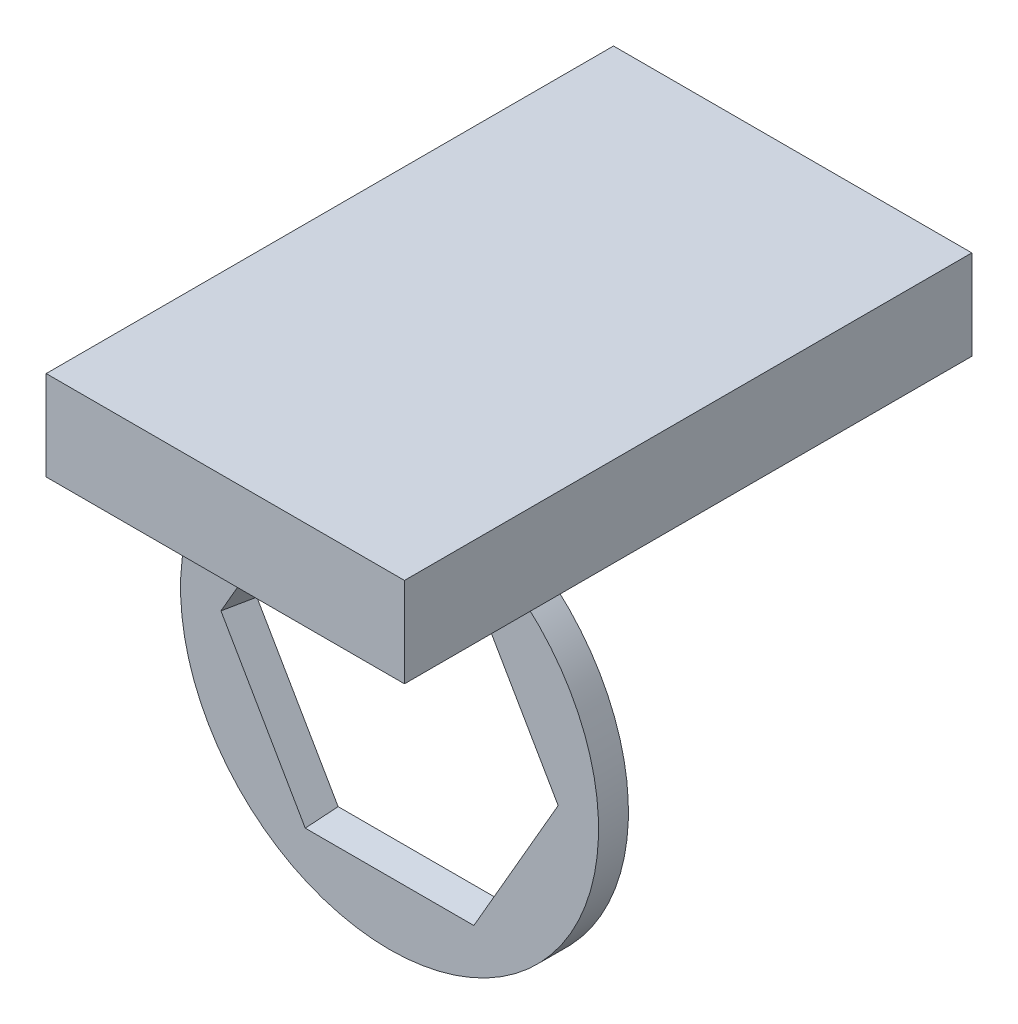
from build123d import *

# Parameters (mm, degrees)
ESQUISSE1_R               = 70
BOSS_EXTRU_1_DEPTH        = 10
CHANFREIN1_SIZE           = 10.000000024
CHANFREIN1_SIZE_2         = 1.74707794
D_PLACER_START            = -32.160153846
D_PLACER_LA_FACE1_DEPTH   = 61.565802755
D_PLACER_START_2          = -29.405648909
D_PLACER_LA_FACE1_2_DEPTH = 58.811297818
D_PLACER_LA_FACE1_3_DEPTH = 58.811297818
ESQUISSE2_W               = 120
ESQUISSE2_H               = 190
BOSS_EXTRU_2_DEPTH        = 30


with BuildPart() as part:
    # Esquisse1 → Boss.-Extru.1 (new body)
    with BuildSketch(Plane.XY):
        Circle(ESQUISSE1_R)
        Polygon((56.79394598, 0), (28.39697299, 49.185), (-28.39697299, 49.185), (-56.79394598, 0), (-28.39697299, -49.185), (28.39697299, -49.185), align=None, mode=Mode.SUBTRACT)
    extrude(amount=BOSS_EXTRU_1_DEPTH)

    # Chanfrein1
    # the kernel refuses this chamfer: 10.000000024, 1.74707794 mm, written as the material it takes off along each edge
    with BuildSketch(Plane(origin=(-54.38262227, -49.185, 10), x_dir=(0, 0, -1), z_dir=(1, 0, 0))) as chanfrein1_piece_1_section:
        Polygon((CHANFREIN1_SIZE, 0), (0, -CHANFREIN1_SIZE_2), (0, 0), align=None)
    chanfrein1_piece_1 = extrude(amount=108.76524454, mode=Mode.PRIVATE)
    chanfrein1_piece_1 = split(chanfrein1_piece_1, bisect_by=Plane(origin=(7.702074175, -85.029616205, 10), z_dir=(-0.8660254037844389, 0.4999999999999996, 0)), keep=Keep.TOP, mode=Mode.PRIVATE)
    chanfrein1_piece_1 = split(chanfrein1_piece_1, bisect_by=Plane(origin=(-34.89338531, -37.932883795, 10), z_dir=(0.8660254037844386, 0.5000000000000001, 0)), keep=Keep.TOP, mode=Mode.PRIVATE)
    add(chanfrein1_piece_1, mode=Mode.SUBTRACT)
    with BuildSketch(Plane(origin=(15.40414835, -71.68923241, 10), x_dir=(0, 0, -1), z_dir=(0.4999999999999996, 0.8660254037844389, 0))) as chanfrein1_piece_2_section:
        Polygon((CHANFREIN1_SIZE, 0), (0, -CHANFREIN1_SIZE_2), (0, 0), align=None)
    chanfrein1_piece_2 = extrude(amount=108.76524454, mode=Mode.PRIVATE)
    chanfrein1_piece_2 = split(chanfrein1_piece_2, bisect_by=Plane(origin=(15.40414835, -49.185, 10), z_dir=(0, 1, 0)), keep=Keep.TOP, mode=Mode.PRIVATE)
    chanfrein1_piece_2 = split(chanfrein1_piece_2, bisect_by=Plane(origin=(77.488844795, -35.844616205, 10), z_dir=(-0.8660254037844386, -0.5000000000000001, 0)), keep=Keep.TOP, mode=Mode.PRIVATE)
    add(chanfrein1_piece_2, mode=Mode.SUBTRACT)
    with BuildSketch(Plane(origin=(69.78677062, -22.50423241, 10), x_dir=(0, 0, -1), z_dir=(-0.5000000000000001, 0.8660254037844386, 0))) as chanfrein1_piece_3_section:
        Polygon((CHANFREIN1_SIZE, 0), (0, -CHANFREIN1_SIZE_2), (0, 0), align=None)
    chanfrein1_piece_3 = extrude(amount=108.76524454, mode=Mode.PRIVATE)
    chanfrein1_piece_3 = split(chanfrein1_piece_3, bisect_by=Plane(origin=(50.29753366, -11.252116205, 10), z_dir=(-0.8660254037844389, 0.4999999999999996, 0)), keep=Keep.TOP, mode=Mode.PRIVATE)
    chanfrein1_piece_3 = split(chanfrein1_piece_3, bisect_by=Plane(origin=(69.78677062, 49.185, 10), z_dir=(0, -1, 0)), keep=Keep.TOP, mode=Mode.PRIVATE)
    add(chanfrein1_piece_3, mode=Mode.SUBTRACT)
    with BuildSketch(Plane(origin=(54.38262227, 49.185, 10), x_dir=(0, 0, -1), z_dir=(-1, 0, 0))) as chanfrein1_piece_4_section:
        Polygon((CHANFREIN1_SIZE, 0), (0, -CHANFREIN1_SIZE_2), (0, 0), align=None)
    chanfrein1_piece_4 = extrude(amount=108.76524454, mode=Mode.PRIVATE)
    chanfrein1_piece_4 = split(chanfrein1_piece_4, bisect_by=Plane(origin=(-7.702074175, 85.029616205, 10), z_dir=(0.8660254037844388, -0.4999999999999998, 0)), keep=Keep.TOP, mode=Mode.PRIVATE)
    chanfrein1_piece_4 = split(chanfrein1_piece_4, bisect_by=Plane(origin=(34.89338531, 37.932883795, 10), z_dir=(-0.8660254037844386, -0.5000000000000001, 0)), keep=Keep.TOP, mode=Mode.PRIVATE)
    add(chanfrein1_piece_4, mode=Mode.SUBTRACT)
    with BuildSketch(Plane(origin=(-15.40414835, 71.68923241, 10), x_dir=(0, 0, -1), z_dir=(-0.4999999999999998, -0.8660254037844388, 0))) as chanfrein1_piece_5_section:
        Polygon((CHANFREIN1_SIZE, 0), (0, -CHANFREIN1_SIZE_2), (0, 0), align=None)
    chanfrein1_piece_5 = extrude(amount=108.76524454, mode=Mode.PRIVATE)
    chanfrein1_piece_5 = split(chanfrein1_piece_5, bisect_by=Plane(origin=(-77.488844795, 35.844616205, 10), z_dir=(0.8660254037844386, 0.5000000000000001, 0)), keep=Keep.TOP, mode=Mode.PRIVATE)
    chanfrein1_piece_5 = split(chanfrein1_piece_5, bisect_by=Plane(origin=(-15.40414835, 49.185, 10), z_dir=(0, -1, 0)), keep=Keep.TOP, mode=Mode.PRIVATE)
    add(chanfrein1_piece_5, mode=Mode.SUBTRACT)
    with BuildSketch(Plane(origin=(-69.78677062, 22.50423241, 10), x_dir=(0, 0, -1), z_dir=(0.5000000000000001, -0.8660254037844386, 0))) as chanfrein1_piece_6_section:
        Polygon((CHANFREIN1_SIZE, 0), (0, -CHANFREIN1_SIZE_2), (0, 0), align=None)
    chanfrein1_piece_6 = extrude(amount=108.76524454, mode=Mode.PRIVATE)
    chanfrein1_piece_6 = split(chanfrein1_piece_6, bisect_by=Plane(origin=(-69.78677062, -49.185, 10), z_dir=(0, 1, 0)), keep=Keep.TOP, mode=Mode.PRIVATE)
    chanfrein1_piece_6 = split(chanfrein1_piece_6, bisect_by=Plane(origin=(-50.29753366, 11.252116205, 10), z_dir=(0.8660254037844388, -0.4999999999999998, 0)), keep=Keep.TOP, mode=Mode.PRIVATE)
    add(chanfrein1_piece_6, mode=Mode.SUBTRACT)
    with BuildSketch(Plane(origin=(-54.38262227, -49.185, 10), x_dir=(0, 0, -1), z_dir=(1, 0, 0))) as chanfrein1_piece_7a_section:
        Polygon((CHANFREIN1_SIZE, 0), (0, -CHANFREIN1_SIZE_2), (0, 0), align=None)
    chanfrein1_piece_7a = extrude(amount=108.76524454, mode=Mode.PRIVATE)
    chanfrein1_piece_7a = split(chanfrein1_piece_7a, bisect_by=Plane(origin=(-34.89338531, -37.932883795, 10), z_dir=(-0.8660254037844386, -0.5000000000000001, 0)), keep=Keep.TOP, mode=Mode.PRIVATE)
    with BuildSketch(Plane(origin=(-69.78677062, 22.50423241, 10), x_dir=(0, 0, -1), z_dir=(0.5000000000000001, -0.8660254037844386, 0))) as chanfrein1_piece_7b_section:
        Polygon((CHANFREIN1_SIZE, 0), (0, -CHANFREIN1_SIZE_2), (0, 0), align=None)
    chanfrein1_piece_7b = extrude(amount=108.76524454, mode=Mode.PRIVATE)
    chanfrein1_piece_7b = split(chanfrein1_piece_7b, bisect_by=Plane(origin=(-69.78677062, -49.185, 10), z_dir=(0, -1, 0)), keep=Keep.TOP, mode=Mode.PRIVATE)
    chanfrein1_piece_7 = chanfrein1_piece_7a & chanfrein1_piece_7b
    add(chanfrein1_piece_7, mode=Mode.SUBTRACT)
    with BuildSketch(Plane(origin=(15.40414835, -71.68923241, 10), x_dir=(0, 0, -1), z_dir=(0.4999999999999996, 0.8660254037844389, 0))) as chanfrein1_piece_8a_section:
        Polygon((CHANFREIN1_SIZE, 0), (0, -CHANFREIN1_SIZE_2), (0, 0), align=None)
    chanfrein1_piece_8a = extrude(amount=108.76524454, mode=Mode.PRIVATE)
    chanfrein1_piece_8a = split(chanfrein1_piece_8a, bisect_by=Plane(origin=(15.40414835, -49.185, 10), z_dir=(0, -1, 0)), keep=Keep.TOP, mode=Mode.PRIVATE)
    with BuildSketch(Plane(origin=(-54.38262227, -49.185, 10), x_dir=(0, 0, -1), z_dir=(1, 0, 0))) as chanfrein1_piece_8b_section:
        Polygon((CHANFREIN1_SIZE, 0), (0, -CHANFREIN1_SIZE_2), (0, 0), align=None)
    chanfrein1_piece_8b = extrude(amount=108.76524454, mode=Mode.PRIVATE)
    chanfrein1_piece_8b = split(chanfrein1_piece_8b, bisect_by=Plane(origin=(7.702074175, -85.029616205, 10), z_dir=(0.8660254037844389, -0.4999999999999996, 0)), keep=Keep.TOP, mode=Mode.PRIVATE)
    chanfrein1_piece_8 = chanfrein1_piece_8a & chanfrein1_piece_8b
    add(chanfrein1_piece_8, mode=Mode.SUBTRACT)
    with BuildSketch(Plane(origin=(15.40414835, -71.68923241, 10), x_dir=(0, 0, -1), z_dir=(0.4999999999999996, 0.8660254037844389, 0))) as chanfrein1_piece_9a_section:
        Polygon((CHANFREIN1_SIZE, 0), (0, -CHANFREIN1_SIZE_2), (0, 0), align=None)
    chanfrein1_piece_9a = extrude(amount=108.76524454, mode=Mode.PRIVATE)
    chanfrein1_piece_9a = split(chanfrein1_piece_9a, bisect_by=Plane(origin=(77.488844795, -35.844616205, 10), z_dir=(0.8660254037844386, 0.5000000000000001, 0)), keep=Keep.TOP, mode=Mode.PRIVATE)
    with BuildSketch(Plane(origin=(69.78677062, -22.50423241, 10), x_dir=(0, 0, -1), z_dir=(-0.5000000000000001, 0.8660254037844386, 0))) as chanfrein1_piece_9b_section:
        Polygon((CHANFREIN1_SIZE, 0), (0, -CHANFREIN1_SIZE_2), (0, 0), align=None)
    chanfrein1_piece_9b = extrude(amount=108.76524454, mode=Mode.PRIVATE)
    chanfrein1_piece_9b = split(chanfrein1_piece_9b, bisect_by=Plane(origin=(50.29753366, -11.252116205, 10), z_dir=(0.8660254037844389, -0.4999999999999996, 0)), keep=Keep.TOP, mode=Mode.PRIVATE)
    chanfrein1_piece_9 = chanfrein1_piece_9a & chanfrein1_piece_9b
    add(chanfrein1_piece_9, mode=Mode.SUBTRACT)
    with BuildSketch(Plane(origin=(54.38262227, 49.185, 10), x_dir=(0, 0, -1), z_dir=(-1, 0, 0))) as chanfrein1_piece_10a_section:
        Polygon((CHANFREIN1_SIZE, 0), (0, -CHANFREIN1_SIZE_2), (0, 0), align=None)
    chanfrein1_piece_10a = extrude(amount=108.76524454, mode=Mode.PRIVATE)
    chanfrein1_piece_10a = split(chanfrein1_piece_10a, bisect_by=Plane(origin=(34.89338531, 37.932883795, 10), z_dir=(0.8660254037844386, 0.5000000000000001, 0)), keep=Keep.TOP, mode=Mode.PRIVATE)
    with BuildSketch(Plane(origin=(69.78677062, -22.50423241, 10), x_dir=(0, 0, -1), z_dir=(-0.5000000000000001, 0.8660254037844386, 0))) as chanfrein1_piece_10b_section:
        Polygon((CHANFREIN1_SIZE, 0), (0, -CHANFREIN1_SIZE_2), (0, 0), align=None)
    chanfrein1_piece_10b = extrude(amount=108.76524454, mode=Mode.PRIVATE)
    chanfrein1_piece_10b = split(chanfrein1_piece_10b, bisect_by=Plane(origin=(69.78677062, 49.185, 10), z_dir=(0, 1, 0)), keep=Keep.TOP, mode=Mode.PRIVATE)
    chanfrein1_piece_10 = chanfrein1_piece_10a & chanfrein1_piece_10b
    add(chanfrein1_piece_10, mode=Mode.SUBTRACT)
    with BuildSketch(Plane(origin=(-15.40414835, 71.68923241, 10), x_dir=(0, 0, -1), z_dir=(-0.4999999999999998, -0.8660254037844388, 0))) as chanfrein1_piece_11a_section:
        Polygon((CHANFREIN1_SIZE, 0), (0, -CHANFREIN1_SIZE_2), (0, 0), align=None)
    chanfrein1_piece_11a = extrude(amount=108.76524454, mode=Mode.PRIVATE)
    chanfrein1_piece_11a = split(chanfrein1_piece_11a, bisect_by=Plane(origin=(-15.40414835, 49.185, 10), z_dir=(0, 1, 0)), keep=Keep.TOP, mode=Mode.PRIVATE)
    with BuildSketch(Plane(origin=(54.38262227, 49.185, 10), x_dir=(0, 0, -1), z_dir=(-1, 0, 0))) as chanfrein1_piece_11b_section:
        Polygon((CHANFREIN1_SIZE, 0), (0, -CHANFREIN1_SIZE_2), (0, 0), align=None)
    chanfrein1_piece_11b = extrude(amount=108.76524454, mode=Mode.PRIVATE)
    chanfrein1_piece_11b = split(chanfrein1_piece_11b, bisect_by=Plane(origin=(-7.702074175, 85.029616205, 10), z_dir=(-0.8660254037844388, 0.4999999999999998, 0)), keep=Keep.TOP, mode=Mode.PRIVATE)
    chanfrein1_piece_11 = chanfrein1_piece_11a & chanfrein1_piece_11b
    add(chanfrein1_piece_11, mode=Mode.SUBTRACT)
    with BuildSketch(Plane(origin=(-69.78677062, 22.50423241, 10), x_dir=(0, 0, -1), z_dir=(0.5000000000000001, -0.8660254037844386, 0))) as chanfrein1_piece_12a_section:
        Polygon((CHANFREIN1_SIZE, 0), (0, -CHANFREIN1_SIZE_2), (0, 0), align=None)
    chanfrein1_piece_12a = extrude(amount=108.76524454, mode=Mode.PRIVATE)
    chanfrein1_piece_12a = split(chanfrein1_piece_12a, bisect_by=Plane(origin=(-50.29753366, 11.252116205, 10), z_dir=(-0.8660254037844388, 0.4999999999999998, 0)), keep=Keep.TOP, mode=Mode.PRIVATE)
    with BuildSketch(Plane(origin=(-15.40414835, 71.68923241, 10), x_dir=(0, 0, -1), z_dir=(-0.4999999999999998, -0.8660254037844388, 0))) as chanfrein1_piece_12b_section:
        Polygon((CHANFREIN1_SIZE, 0), (0, -CHANFREIN1_SIZE_2), (0, 0), align=None)
    chanfrein1_piece_12b = extrude(amount=108.76524454, mode=Mode.PRIVATE)
    chanfrein1_piece_12b = split(chanfrein1_piece_12b, bisect_by=Plane(origin=(-77.488844795, 35.844616205, 10), z_dir=(-0.8660254037844386, -0.5000000000000001, 0)), keep=Keep.TOP, mode=Mode.PRIVATE)
    chanfrein1_piece_12 = chanfrein1_piece_12a & chanfrein1_piece_12b
    add(chanfrein1_piece_12, mode=Mode.SUBTRACT)

    # Déplacer la face1: read off the stored shape, not the designer's step
    # Déplacer la face1 outline → Déplacer la face1 (add)
    with BuildSketch(Plane.YZ.offset(D_PLACER_START)):
        Polygon((49.185000004, -1e-09), (50.93207794, 10), (48.901784549, 10), (47.154706614, 0), align=None)
        Polygon((-47.154706614, 0), (-48.901784549, 10), (-50.93207794, 10), (-49.185000004, -1e-09), align=None)
    extrude(amount=D_PLACER_LA_FACE1_DEPTH)

    # D_placer la face1 2 outline → D_placer la face1 2 (add)
    with BuildSketch(Plane(origin=(0, 0, 0), x_dir=(0.8660254037844389, -0.49999999999999956, 0), z_dir=(0.4999999999999996, 0.8660254037844388, 0)).offset(D_PLACER_START_2)):
        Polygon((-49.185000004, 1e-09), (-50.93207794, -10), (-48.901784549, -10), (-47.154706614, 0), align=None)
        Polygon((47.154706614, 0), (48.901784549, -10), (50.93207794, -10), (49.185000004, 1e-09), align=None)
    extrude(amount=D_PLACER_LA_FACE1_2_DEPTH)

    # D_placer la face1 3 outline → D_placer la face1 3 (add)
    with BuildSketch(Plane(origin=(0, 0, 0), x_dir=(0.8660254037844386, 0.5000000000000001, 0), z_dir=(0.5000000000000001, -0.8660254037844386, 0)).offset(D_PLACER_START_2)):
        Polygon((49.185000004, -1e-09), (50.93207794, 10), (48.901784549, 10), (47.154706614, 0), align=None)
        Polygon((-47.154706614, 0), (-48.901784549, 10), (-50.93207794, 10), (-49.185000004, -1e-09), align=None)
    extrude(amount=D_PLACER_LA_FACE1_3_DEPTH)

    # Esquisse2 → Boss.-Extru.2 (add)
    with BuildSketch(Plane(origin=(0, 94.56764827, 0), x_dir=(1, 0, 0), z_dir=(0, 1, 0))):
        with Locations((0, 30)):
            Rectangle(ESQUISSE2_W, ESQUISSE2_H)
    extrude(amount=-BOSS_EXTRU_2_DEPTH)


solid = part.part
